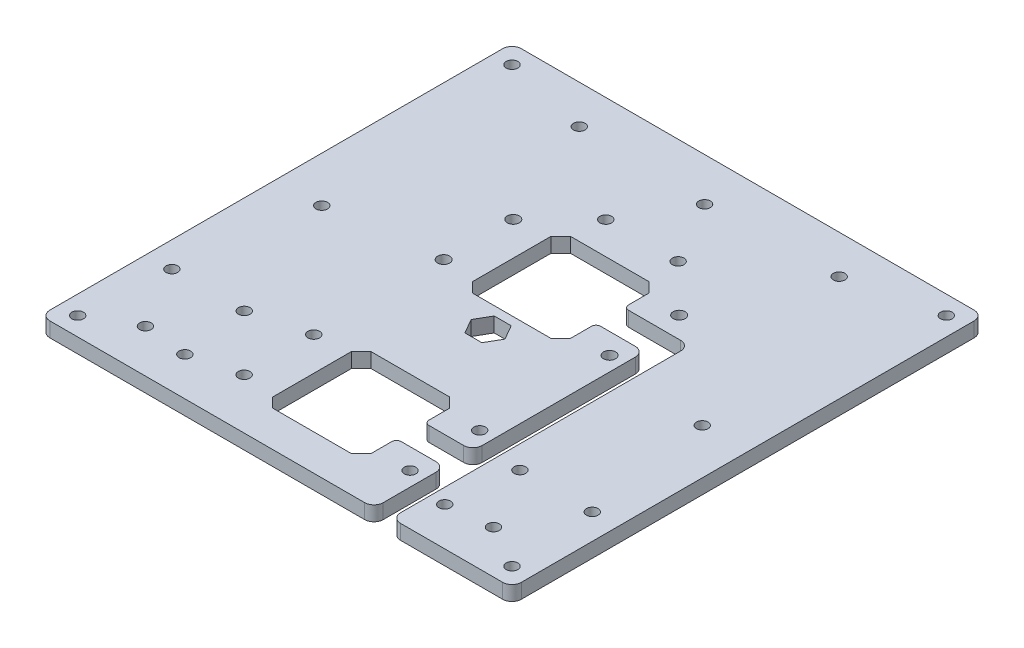
from build123d import *

# Parameters (mm, degrees)
ESQUISSE1_W              = 203.2
ESQUISSE1_H              = 203.2
BOSS_EXTRU_1_DEPTH       = 6.35
ESQUISSE2_R              = 2.5
ENL_V_MAT_EXTRU_1_DEPTH  = 144.824345992
ESQUISSE3_R              = 2.5
ENL_V_MAT_EXTRU_2_DEPTH  = 144.824345992
ESQUISSE4_R              = 2.5
ENL_V_MAT_EXTRU_3_DEPTH  = 144.824345992
ESQUISSE6_R              = 2.5
ENL_V_MAT_EXTRU_5_DEPTH  = 144.824345992
ENL_V_MAT_EXTRU_9_DEPTH  = 144.824345992
ENL_V_MAT_EXTRU_4_DEPTH  = 144.824345992
ENL_V_MAT_EXTRU_7_DEPTH  = 144.824345992
ENL_V_MAT_EXTRU_8_DEPTH  = 144.824345992
CONG_3_R                 = 2
CONG_2_R                 = 4
ESQUISSE12_R             = 2.6
ENL_V_MAT_EXTRU_10_DEPTH = 144.824345992


with BuildPart() as part:
    # Esquisse1 → Boss.-Extru.1 (new body)
    with BuildSketch(Plane(origin=(0, 0, 0), x_dir=(1, 0, 0), z_dir=(0, 1, 0))):
        Rectangle(ESQUISSE1_W, ESQUISSE1_H)
    extrude(amount=BOSS_EXTRU_1_DEPTH)

    # Esquisse2 → Enlèv. mat.-Extru.1 (cut, through all)
    with BuildSketch(Plane(origin=(0, 6.35, 0), x_dir=(1, 0, 0), z_dir=(0, 1, 0))):
        with Locations((-35.6, -49.85)):
            Circle(ESQUISSE2_R)
        with Locations((-35.6, -79.85)):
            Circle(ESQUISSE2_R)
        with Locations((35.9, -79.85)):
            Circle(ESQUISSE2_R)
        with Locations((35.9, -49.85)):
            Circle(ESQUISSE2_R)
    extrude(amount=-ENL_V_MAT_EXTRU_1_DEPTH, mode=Mode.SUBTRACT)

    # Esquisse3 → Enlèv. mat.-Extru.2 (cut, through all)
    with BuildSketch(Plane(origin=(0, 6.35, 0), x_dir=(1, 0, 0), z_dir=(0, 1, 0))):
        with Locations((-93.6, 93.6)):
            Circle(ESQUISSE3_R)
        with Locations((93.6, 93.6)):
            Circle(ESQUISSE3_R)
        with Locations((93.6, -93.6)):
            Circle(ESQUISSE3_R)
        with Locations((-93.6, -93.6)):
            Circle(ESQUISSE3_R)
    extrude(amount=-ENL_V_MAT_EXTRU_2_DEPTH, mode=Mode.SUBTRACT)

    # Esquisse4 → Enlèv. mat.-Extru.3 (cut, through all)
    with BuildSketch(Plane(origin=(0, 6.35, 0), x_dir=(1, 0, 0), z_dir=(0, 1, 0))):
        with Locations((15.588457268, 56)):
            Circle(ESQUISSE4_R)
        with Locations((-15.588457268, 56)):
            Circle(ESQUISSE4_R)
        with Locations((0, 83)):
            Circle(ESQUISSE4_R)
        with Locations((-75, -83)):
            Circle(ESQUISSE4_R)
        with Locations((-90.588457268, -56)):
            Circle(ESQUISSE4_R)
        with Locations((-59.411542732, -56)):
            Circle(ESQUISSE4_R)
        with Locations((59.413008586, -55.999154304)):
            Circle(ESQUISSE4_R)
        with Locations((90.589923123, -55.999154304)):
            Circle(ESQUISSE4_R)
        with Locations((75.001465855, -82.999154304)):
            Circle(ESQUISSE4_R)
    extrude(amount=-ENL_V_MAT_EXTRU_3_DEPTH, mode=Mode.SUBTRACT)

    # Esquisse6 → Enlèv. mat.-Extru.5 (cut, through all)
    with BuildSketch(Plane.XZ):
        with Locations((-56, 85)):
            Circle(ESQUISSE6_R)
        with Locations((-56, -85)):
            Circle(ESQUISSE6_R)
        with Locations((-82, 0)):
            Circle(ESQUISSE6_R)
    enl_v_mat_extru_5 = extrude(amount=-ENL_V_MAT_EXTRU_5_DEPTH, mode=Mode.SUBTRACT)

    # Symétrie1: Enlèv. mat.-Extru.5 across plane
    add(enl_v_mat_extru_5.mirror(Plane(origin=(0, 0, 0), x_dir=(0, 0, 1), z_dir=(1, 0, 0))), mode=Mode.SUBTRACT)

    # Esquisse11 → Enlèv. mat.-Extru.9 (cut, through all)
    with BuildSketch(Plane(origin=(0, 6.35, 0), x_dir=(1, 0, 0), z_dir=(0, 1, 0))):
        Polygon((-16.978069991, 42.150000003), (16.978069991, 42.150000003), (21.15, 37.978069994), (21.15, 4.021930012), (16.978069991, -0.149999997), (-16.978069991, -0.149999997), (-21.15, 4.021930012), (-21.15, 37.978069994), align=None)
    extrude(amount=-ENL_V_MAT_EXTRU_9_DEPTH, mode=Mode.SUBTRACT)

    # Esquisse5 → Enlèv. mat.-Extru.4 (cut, through all)
    with BuildSketch(Plane(origin=(0, 6.35, 0), x_dir=(1, 0, 0), z_dir=(0, 1, 0))):
        Polygon((3.651740453, -4), (-3.651740453, -4), (-7.303480905, -10.325), (-3.651740453, -16.65), (3.651740453, -16.65), (7.303480905, -10.325), align=None)
    extrude(amount=-ENL_V_MAT_EXTRU_4_DEPTH, mode=Mode.SUBTRACT)

    # Esquisse9 → Enlèv. mat.-Extru.7 (cut, through all)
    with BuildSketch(Plane(origin=(0, 6.35, 0), x_dir=(1, 0, 0), z_dir=(0, 1, 0))):
        Polygon((-16.978069991, -43.85), (16.978069991, -43.85), (21.15, -48.021930009), (21.15, -81.978069991), (16.978069991, -86.15), (-16.978069991, -86.15), (-21.15, -81.978069991), (-21.15, -48.021930009), align=None)
    extrude(amount=-ENL_V_MAT_EXTRU_7_DEPTH, mode=Mode.SUBTRACT)

    # Esquisse10 → Enlèv. mat.-Extru.8 (cut, through all)
    with BuildSketch(Plane(origin=(0, 6.35, 0), x_dir=(1, 0, 0), z_dir=(0, 1, 0))):
        Polygon((21.15, -58.928069991), (42.1, -58.928069991), (42.1, 15.071930012), (21.15, 15.071930012), (21.15, 27.071930012), (49.6, 27.071930012), (49.6, 15.071930012), (49.6, -58.928069991), (49.6, -70.928069991), (49.6, -101.6), (42.1, -101.6), (42.1, -70.928069991), (21.15, -70.928069991), align=None)
    extrude(amount=-ENL_V_MAT_EXTRU_8_DEPTH, mode=Mode.SUBTRACT)

    # Congé3
    cong_3_edges = [part.edges().sort_by_distance(p)[0] for p in [
        (21.15, 3.175, 70.928069991),
        (21.15, 3.175, 58.928069991),
        (21.15, 3.175, -15.071930012),
        (21.15, 3.175, -27.071930012),
    ]]
    fillet(cong_3_edges, radius=CONG_3_R)

    # Congé2
    cong_2_edges = [part.edges().sort_by_distance(p)[0] for p in [
        (101.6, 3.175, -101.6),
        (-101.6, 3.175, -101.6),
        (-101.6, 3.175, 101.6),
        (101.6, 3.175, 101.6),
        (42.1, 3.175, 70.928069991),
        (49.6, 3.175, 101.6),
        (42.1, 3.175, 101.6),
        (42.1, 3.175, 58.928069991),
        (42.1, 3.175, -15.071930012),
        (49.6, 3.175, -27.071930012),
    ]]
    fillet(cong_2_edges, radius=CONG_2_R)

    # Esquisse12 → Enlèv. mat.-Extru.10 (cut, through all)
    with BuildSketch(Plane(origin=(0, 6.35, 0), x_dir=(1, 0, 0), z_dir=(0, 1, 0))):
        with Locations((-35.6, 36.15)):
            Circle(ESQUISSE12_R)
        with Locations((-35.6, 6.15)):
            Circle(ESQUISSE12_R)
        with Locations((35.9, 6.15)):
            Circle(ESQUISSE12_R)
        with Locations((35.9, 36.15)):
            Circle(ESQUISSE12_R)
    extrude(amount=-ENL_V_MAT_EXTRU_10_DEPTH, mode=Mode.SUBTRACT)


solid = part.part
